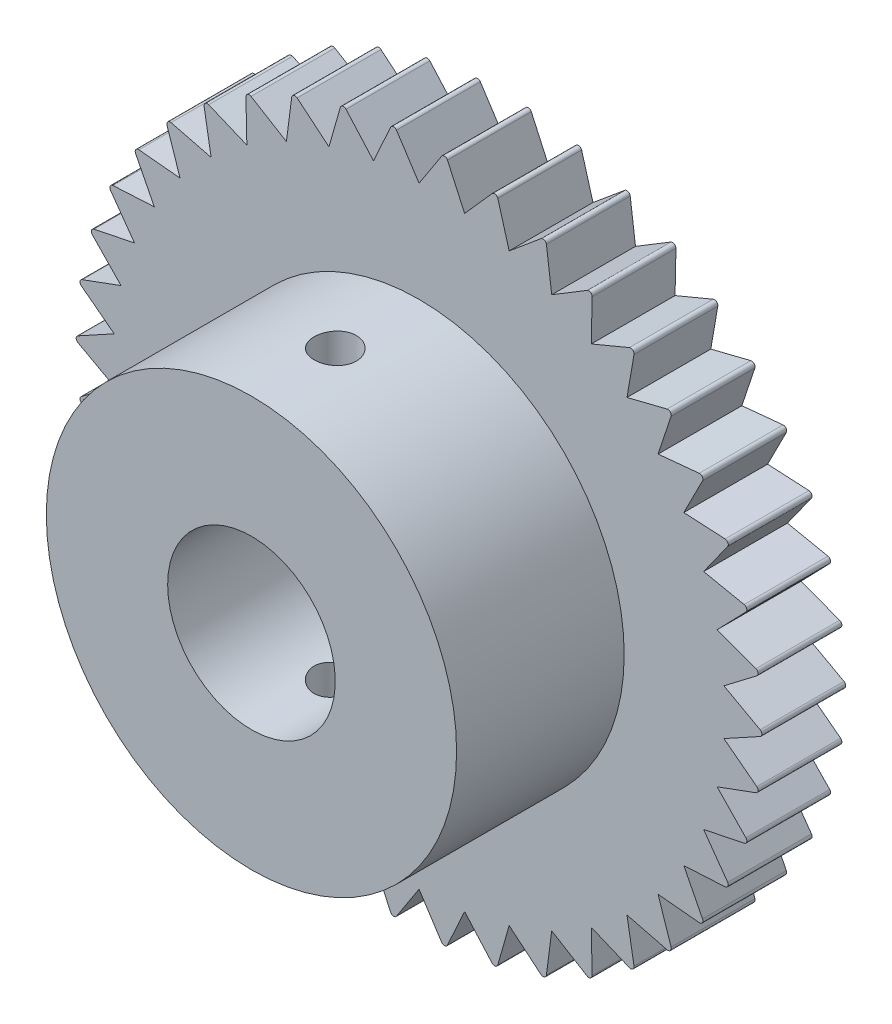
from build123d import *

# Parameters (mm, degrees)
CUT_EXTRUDE3_DEPTH      = 20.694780667
CUT_EXTRUDE3_DEPTH_BACK = 20.694780667
SKETCH3_OUTSIDE_W       = 36.062
SKETCH3_OUTSIDE_H       = 36.062
FILLET1_R               = 0.127
CUT_EXTRUDE4_DEPTH      = 21.669765453
CUT_EXTRUDE4_DEPTH_BACK = 21.669765453
SKETCH4_R               = 0.8001


with BuildPart() as part:
    # Sketch2 → Revolve1 (revolve)
    with BuildSketch(Plane(origin=(0, 0, 0), x_dir=(0, 0, -1), z_dir=(1, 0, 0))):
        Polygon((0, 3.175), (0, 13.1826), (-3.175, 13.1826), (-3.175, 7.7724), (-9.525, 7.7724), (-9.525, 3.175), align=None)
    revolve(axis=Axis((0, 0, -6.785443847), (0, 0, 1)))

    # Sketch3 outside → Cut-Extrude3 (cut, two sides: drawn at the far end of the back side and taken through both)
    with BuildSketch(Plane.XY.offset(3.175).offset(-CUT_EXTRUDE3_DEPTH_BACK)):
        Rectangle(SKETCH3_OUTSIDE_W, SKETCH3_OUTSIDE_H)
        Polygon((2.920854067, 12.797097812), (1.726267144, 11.453034162), (0.980922082, 13.089495512), (0, 11.5824), (-0.980922082, 13.089495512), (-1.726267144, 11.453034162), (-2.920854067, 12.797097812), (-3.413972332, 11.067826466), (-4.795538999, 12.218834094), (-5.02541502, 10.435381816), (-6.563099513, 11.367621812), (-6.524598241, 9.56982798), (-8.18405123, 10.262475644), (-7.878032718, 8.4905), (-9.622184767, 8.928082729), (-9.055484963, 7.221508281), (-10.845374595, 7.394251198), (-10.030652637, 5.7912), (-11.826296677, 5.695244314), (-10.781752106, 4.231525881), (-12.543038834, 3.869015084), (-11.29200505, 2.577326465), (-12.979590229, 1.956358449), (-11.55001326, 0.865553836), (-13.126199027, 0), (-11.55001326, -0.865553836), (-12.979590229, -1.956358449), (-11.29200505, -2.577326465), (-12.543038834, -3.869015084), (-10.781752106, -4.231525881), (-11.826296677, -5.695244314), (-10.030652637, -5.7912), (-10.845374595, -7.394251198), (-9.055484963, -7.221508281), (-9.622184767, -8.928082729), (-7.878032718, -8.4905), (-8.18405123, -10.262475644), (-6.524598241, -9.56982798), (-6.563099513, -11.367621812), (-5.02541502, -10.435381816), (-4.795538999, -12.218834094), (-3.413972332, -11.067826466), (-2.920854067, -12.797097812), (-1.726267144, -11.453034162), (-0.980922082, -13.089495512), (0, -11.5824), (0.980922082, -13.089495512), (1.726267144, -11.453034162), (2.920854067, -12.797097812), (3.413972332, -11.067826466), (4.795538999, -12.218834094), (5.02541502, -10.435381816), (6.563099513, -11.367621812), (6.524598241, -9.56982798), (8.18405123, -10.262475644), (7.878032718, -8.4905), (9.622184767, -8.928082729), (9.055484963, -7.221508281), (10.845374595, -7.394251198), (10.030652637, -5.7912), (11.826296677, -5.695244314), (10.781752106, -4.231525881), (12.543038834, -3.869015084), (11.29200505, -2.577326465), (12.979590229, -1.956358449), (11.55001326, -0.865553836), (13.126199027, 0), (11.55001326, 0.865553836), (12.979590229, 1.956358449), (11.29200505, 2.577326465), (12.543038834, 3.869015084), (10.781752106, 4.231525881), (11.826296677, 5.695244314), (10.030652637, 5.7912), (10.845374595, 7.394251198), (9.055484963, 7.221508281), (9.622184767, 8.928082729), (7.878032718, 8.4905), (8.18405123, 10.262475644), (6.524598241, 9.56982798), (6.563099513, 11.367621812), (5.02541502, 10.435381816), (4.795538999, 12.218834094), (3.413972332, 11.067826466), align=None, mode=Mode.SUBTRACT)
    extrude(amount=CUT_EXTRUDE3_DEPTH + CUT_EXTRUDE3_DEPTH_BACK, mode=Mode.SUBTRACT)

    # Fillet1
    fillet1_edges = [part.edges().sort_by_distance(p)[0] for p in [
        (-10.845374595, -7.394251198, 1.5875),
        (-11.826296677, -5.695244314, 1.5875),
        (-12.543038834, -3.869015084, 1.5875),
        (-12.979590229, -1.956358449, 1.5875),
        (-13.126199027, 0, 1.5875),
        (-12.979590229, 1.956358449, 1.5875),
        (-12.543038834, 3.869015084, 1.5875),
        (-11.826296677, 5.695244314, 1.5875),
        (-10.845374595, 7.394251198, 1.5875),
        (-9.622184767, 8.928082729, 1.5875),
        (-8.18405123, 10.262475644, 1.5875),
        (-6.563099513, 11.367621812, 1.5875),
        (-4.795538999, 12.218834094, 1.5875),
        (-2.920854067, 12.797097812, 1.5875),
        (-0.980922082, 13.089495512, 1.5875),
        (0.980922082, 13.089495512, 1.5875),
        (2.920854067, 12.797097812, 1.5875),
        (4.795538999, 12.218834094, 1.5875),
        (6.563099513, 11.367621812, 1.5875),
        (8.18405123, 10.262475644, 1.5875),
        (9.622184767, 8.928082729, 1.5875),
        (10.845374595, 7.394251198, 1.5875),
        (11.826296677, 5.695244314, 1.5875),
        (12.543038834, 3.869015084, 1.5875),
        (12.979590229, 1.956358449, 1.5875),
        (13.126199027, 0, 1.5875),
        (12.979590229, -1.956358449, 1.5875),
        (-9.622184767, -8.928082729, 1.5875),
        (-8.18405123, -10.262475644, 1.5875),
        (-6.563099513, -11.367621812, 1.5875),
        (-4.795538999, -12.218834094, 1.5875),
        (-2.920854067, -12.797097812, 1.5875),
        (-0.980922082, -13.089495512, 1.5875),
        (0.980922082, -13.089495512, 1.5875),
        (2.920854067, -12.797097812, 1.5875),
        (4.795538999, -12.218834094, 1.5875),
        (6.563099513, -11.367621812, 1.5875),
        (8.18405123, -10.262475644, 1.5875),
        (9.622184767, -8.928082729, 1.5875),
        (10.845374595, -7.394251198, 1.5875),
        (11.826296677, -5.695244314, 1.5875),
        (12.543038834, -3.869015084, 1.5875),
    ]]
    fillet(fillet1_edges, radius=FILLET1_R)

    # Sketch4 → Cut-Extrude4 (cut, two sides: drawn at the far end of the back side and taken through both)
    with BuildSketch(Plane(origin=(0, 0, 0), x_dir=(1, 0, 0), z_dir=(0, 1, 0)).offset(-CUT_EXTRUDE4_DEPTH_BACK)):
        with Locations((0, -6.35)):
            Circle(SKETCH4_R)
    extrude(amount=CUT_EXTRUDE4_DEPTH + CUT_EXTRUDE4_DEPTH_BACK, mode=Mode.SUBTRACT)


solid = part.part
